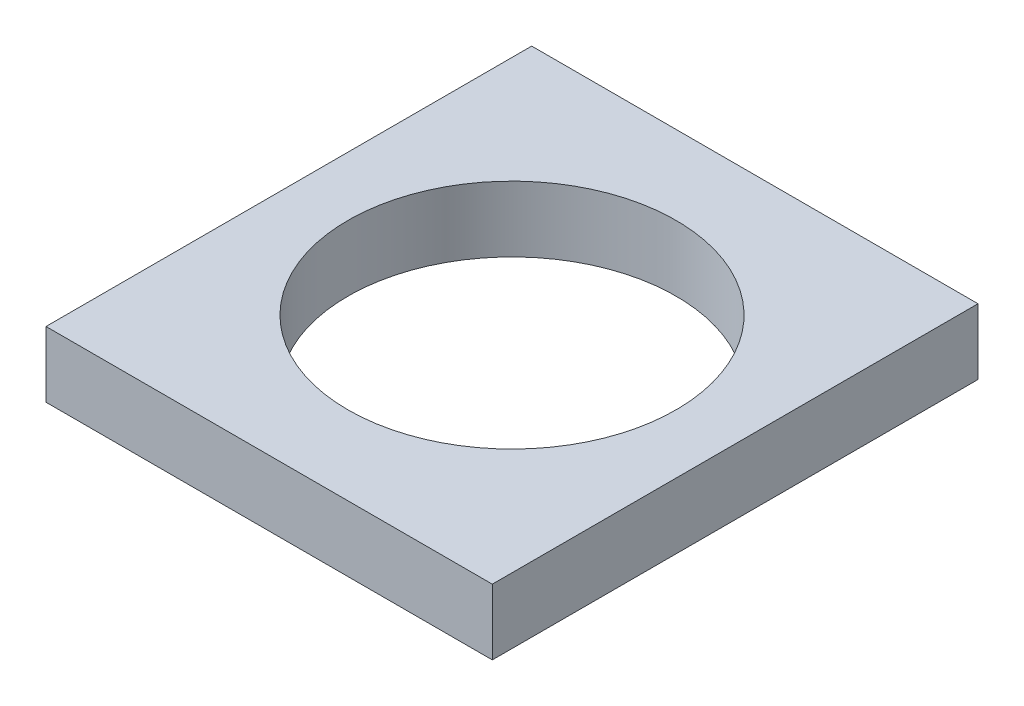
from build123d import *

# Parameters (mm, degrees)
CROQUIS1_W            = 34
CROQUIS1_H            = 37
BRIDA_BASE1_DEPTH     = 5
CROQUIS5_R            = 12.5
CORTAR_EXTRUIR1_DEPTH = 26.617376915


# Sheet-metal steps are written as plain solids
with BuildPart() as part:
    # Croquis1 → Brida base1 (new body)
    with BuildSketch(Plane(origin=(0, 0, 0), x_dir=(1, 0, 0), z_dir=(0, 1, 0))):
        Rectangle(CROQUIS1_W, CROQUIS1_H)
    extrude(amount=-BRIDA_BASE1_DEPTH)

    # Croquis5 → Cortar-Extruir1 (cut, through all)
    with BuildSketch(Plane(origin=(0, 0, 0), x_dir=(1, 0, 0), z_dir=(0, 1, 0))):
        with Locations(Location((0, 0, 0), (0, 0, 270))):
            Circle(CROQUIS5_R)
    extrude(amount=-CORTAR_EXTRUIR1_DEPTH, mode=Mode.SUBTRACT)


solid = part.part
